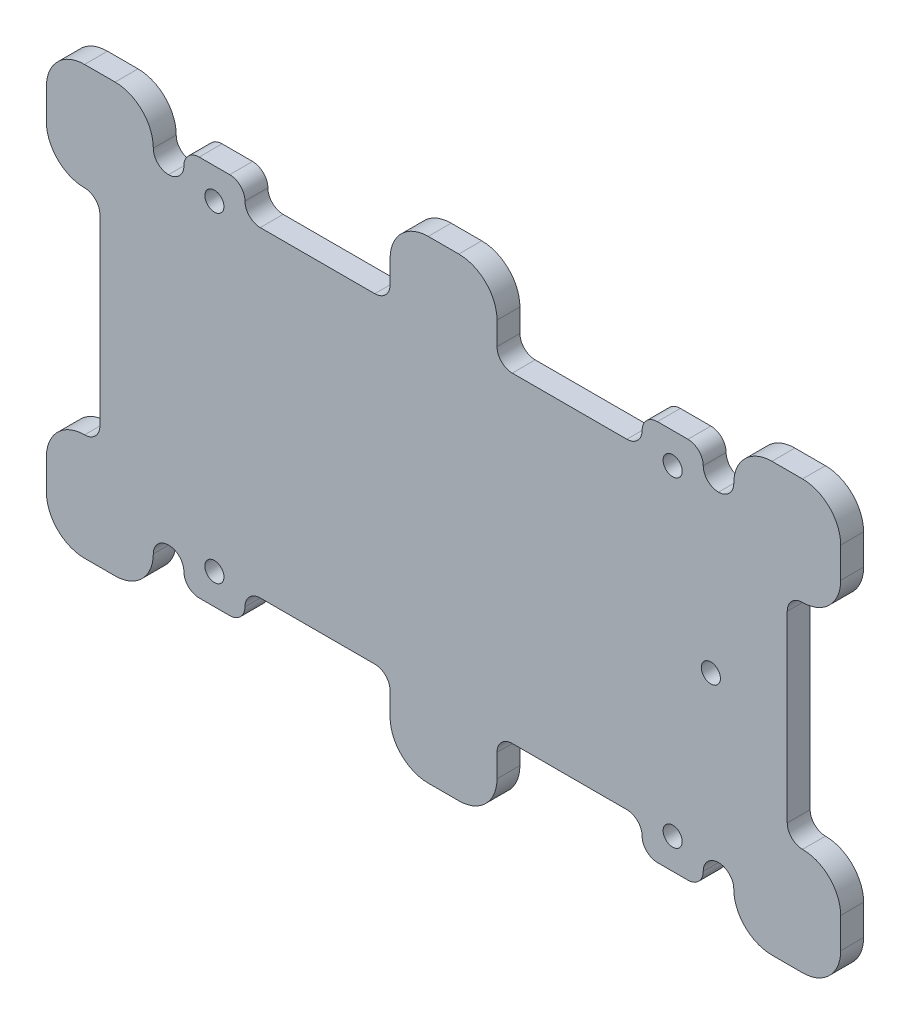
from build123d import *

# Parameters (mm, degrees)
SKETCH1_W           = 90
SKETCH1_H           = 42
SKETCH1_W_2         = 14
SKETCH1_H_2         = 14
SKETCH1_H_3         = 20
SKETCH1_W_3         = 8
SKETCH1_H_4         = 8
BOSS_EXTRUDE1_DEPTH = 3
FILLET1_R           = 5
FILLET2_R           = 2
SKETCH3_R           = 1.25
CUT_EXTRUDE1_DEPTH  = 3
SKETCH4_R           = 1.25
CUT_EXTRUDE2_DEPTH  = 3


with BuildPart() as part:
    # Sketch1 → Boss-Extrude1 (new body)
    with BuildSketch(Plane.XY):
        Rectangle(SKETCH1_W, SKETCH1_H)
        with Locations((-45, 21)):
            Rectangle(SKETCH1_W_2, SKETCH1_H_2)
        with Locations((45, 21)):
            Rectangle(SKETCH1_W_2, SKETCH1_H_2)
        with Locations((45, -21)):
            Rectangle(SKETCH1_W_2, SKETCH1_H_2)
        with Locations((-45, -21)):
            Rectangle(SKETCH1_W_2, SKETCH1_H_2)
        with Locations((0, 21)):
            Rectangle(SKETCH1_W_2, SKETCH1_H_3)
        with Locations((0, -21)):
            Rectangle(SKETCH1_W_2, SKETCH1_H_3)
        with Locations((30, 21)):
            Rectangle(SKETCH1_W_3, SKETCH1_H_4)
        with Locations((-30, 21)):
            Rectangle(SKETCH1_W_3, SKETCH1_H_4)
        with Locations((30, -21)):
            Rectangle(SKETCH1_W_3, SKETCH1_H_4)
        with Locations((-30, -21)):
            Rectangle(SKETCH1_W_3, SKETCH1_H_4)
    extrude(amount=BOSS_EXTRUDE1_DEPTH)

    # Fillet1
    fillet1_edges = [part.edges().sort_by_distance(p)[0] for p in [
        (52, 14, 1.5),
        (52, 28, 1.5),
        (38, 28, 1.5),
        (7, 31, 1.5),
        (-7, 31, 1.5),
        (-38, 28, 1.5),
        (-52, 28, 1.5),
        (-52, 14, 1.5),
        (-52, -14, 1.5),
        (-52, -28, 1.5),
        (-38, -28, 1.5),
        (-7, -31, 1.5),
        (7, -31, 1.5),
        (38, -28, 1.5),
        (52, -28, 1.5),
        (52, -14, 1.5),
    ]]
    fillet(fillet1_edges, radius=FILLET1_R)

    # Fillet2
    fillet2_edges = [part.edges().sort_by_distance(p)[0] for p in [
        (-26, 25, 1.5),
        (-26, 21, 1.5),
        (-34, 25, 1.5),
        (-34, 21, 1.5),
        (-38, 21, 1.5),
        (34, 21, 1.5),
        (7, 21, 1.5),
        (26, 25, 1.5),
        (34, 25, 1.5),
        (38, 21, 1.5),
        (26, 21, 1.5),
        (-7, 21, 1.5),
        (45, 14, 1.5),
        (45, -14, 1.5),
        (38, -21, 1.5),
        (34, -21, 1.5),
        (34, -25, 1.5),
        (26, -25, 1.5),
        (26, -21, 1.5),
        (-7, -21, 1.5),
        (7, -21, 1.5),
        (-26, -21, 1.5),
        (-26, -25, 1.5),
        (-34, -25, 1.5),
        (-34, -21, 1.5),
        (-38, -21, 1.5),
        (-45, -14, 1.5),
        (-45, 14, 1.5),
    ]]
    fillet(fillet2_edges, radius=FILLET2_R - 0.0001)  # a hair under: the kernel refuses the full size

    # Sketch3 → Cut-Extrude1 (cut)
    with BuildSketch(Plane.XY.offset(3)):
        with Locations((-30, 21)):
            Circle(SKETCH3_R)
        with Locations((30, 21)):
            Circle(SKETCH3_R)
        with Locations((30, -21)):
            Circle(SKETCH3_R)
        with Locations((-30, -21)):
            Circle(SKETCH3_R)
    extrude(amount=-CUT_EXTRUDE1_DEPTH, mode=Mode.SUBTRACT)

    # Sketch4 → Cut-Extrude2 (cut)
    with BuildSketch(Plane.XY.offset(3)):
        with Locations((35, 0)):
            Circle(SKETCH4_R)
    extrude(amount=-CUT_EXTRUDE2_DEPTH, mode=Mode.SUBTRACT)


solid = part.part
